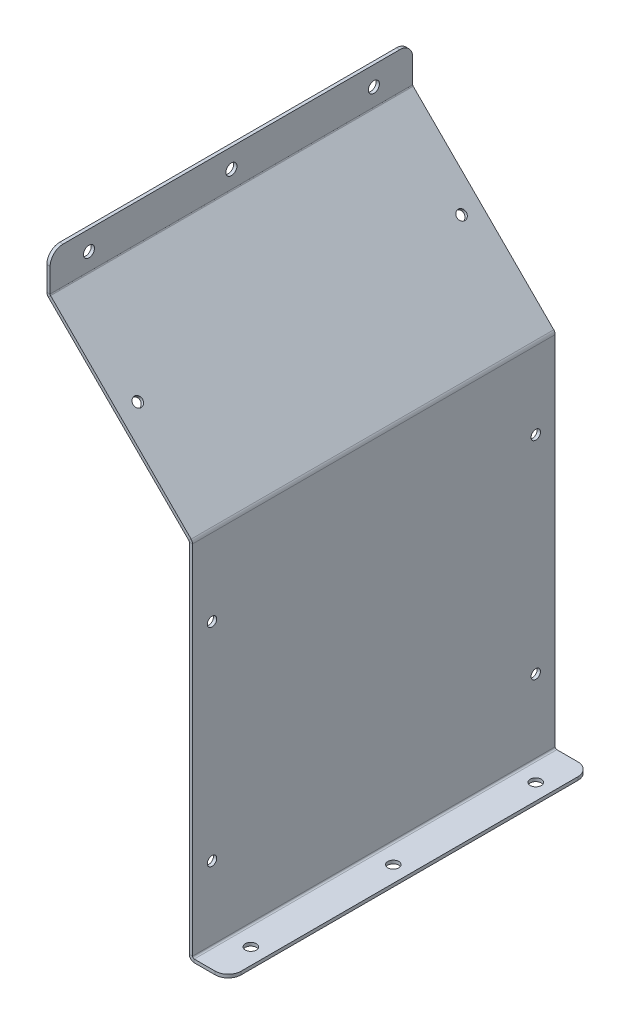
from build123d import *

# Parameters (mm, degrees)
BASE_FLANGE1_DEPTH       = 177.8
SKETCH2_R                = 2.7051
CUT_EXTRUDE1_0213_DEPTH  = 7.62
SKETCH3_R                = 2.3114
CUT_EXTRUDE2_0_182_DEPTH = 7.62
SKETCH4_R                = 2.3114
CUT_EXTRUDE4_0_182_DEPTH = 7.62
SKETCH5_R                = 2.7051
CUT_EXTRUDE3_0_213_DEPTH = 7.62
FILLET1_R                = 6.35


# Sheet-metal steps are written as plain solids
with BuildPart() as part:
    # Sketch1 → Base-Flange1 (new body)
    with BuildSketch(Plane.XY):
        with BuildLine():
            Line((-139.7, 266.7), (-139.7, 248.649497326))
            ThreePointArc((-139.7, 248.649497326), (-139.516321312, 247.726082204), (-138.993248663, 246.943248663))
            Line((-138.993248663, 246.943248663), (-70.088063608, 178.038063608))
            ThreePointArc((-70.088063608, 178.038063608), (-69.911870716, 177.77437231), (-69.85, 177.463327217))
            Line((-69.85, 177.463327217), (-69.85, 2.413))
            ThreePointArc((-69.85, 2.413), (-69.143248663, 0.706751337), (-67.437, 0))
            Line((-67.437, 0), (-50.8, 0))
            Line((-50.8, 0), (-50.8, 1.6002))
            Line((-50.8, 1.6002), (-67.437, 1.6002))
            ThreePointArc((-67.437, 1.6002), (-68.011736392, 1.838263608), (-68.2498, 2.413))
            Line((-68.2498, 2.413), (-68.2498, 177.463327217))
            ThreePointArc((-68.2498, 177.463327216), (-68.433478688, 178.386742339), (-68.956551337, 179.16957588))
            Line((-68.956551337, 179.16957588), (-137.861736392, 248.074760934))
            ThreePointArc((-137.861736392, 248.074760934), (-138.037929284, 248.338452232), (-138.0998, 248.649497326))
            Line((-138.0998, 248.649497326), (-138.0998, 266.7))
            Line((-138.0998, 266.7), (-139.7, 266.7))
        make_face()
    extrude(amount=BASE_FLANGE1_DEPTH)

    # Sketch2 → Cut-Extrude1 .0213 (cut)
    with BuildSketch(Plane.XZ):
        with Locations(Location((-58.7248, 19.05, 0), (0, 0, 270))):
            Circle(SKETCH2_R)
        with Locations(Location((-58.7248, 88.9, 0), (0, 0, 270))):
            Circle(SKETCH2_R)
        with Locations(Location((-58.7248, 158.75, 0), (0, 0, 270))):
            Circle(SKETCH2_R)
    extrude(amount=-CUT_EXTRUDE1_0213_DEPTH, mode=Mode.SUBTRACT)

    # Sketch3 → Cut-Extrude2 0.182 (cut)
    with BuildSketch(Plane(origin=(-68.2498, 0, 0), x_dir=(0, 0, -1), z_dir=(1, 0, 0))):
        with Locations(Location((-168.275, 139.7, 0), (0, 0, 90))):
            Circle(SKETCH3_R)
        with Locations(Location((-168.275, 38.1, 0), (0, 0, 90))):
            Circle(SKETCH3_R)
        with Locations(Location((-9.525, 139.7, 0), (0, 0, 90))):
            Circle(SKETCH3_R)
        with Locations(Location((-9.525, 38.1, 0), (0, 0, 90))):
            Circle(SKETCH3_R)
    extrude(amount=-CUT_EXTRUDE2_0_182_DEPTH, mode=Mode.SUBTRACT)

    # Sketch4 → Cut-Extrude4 0.182 (cut)
    with BuildSketch(Plane(origin=(55.106512271, 55.106512271, 0), x_dir=(0, 0, -1), z_dir=(0.7071067811865511, 0.707106781186544, 0))):
        with Locations(Location((-168.275, 225.914994361, 0), (0, 0, 90))):
            Circle(SKETCH4_R)
        with Locations(Location((-9.525, 225.914994361, 0), (0, 0, 90))):
            Circle(SKETCH4_R)
    extrude(amount=-CUT_EXTRUDE4_0_182_DEPTH, mode=Mode.SUBTRACT)

    # Sketch5 → Cut-Extrude3 0.213 (cut)
    with BuildSketch(Plane(origin=(-138.0998, 0, 0), x_dir=(0, 0, -1), z_dir=(1, 0, 0))):
        with Locations((-158.75, 257.175)):
            Circle(SKETCH5_R)
        with Locations((-88.9, 257.175)):
            Circle(SKETCH5_R)
        with Locations((-19.05, 257.175)):
            Circle(SKETCH5_R)
    extrude(amount=-CUT_EXTRUDE3_0_213_DEPTH, mode=Mode.SUBTRACT)

    # Fillet1
    fillet1_edges = [part.edges().sort_by_distance(p)[0] for p in [
        (-50.8, 0.8001, 0),
        (-138.8999, 266.7, 0),
        (-50.8, 0.8001, 177.8),
        (-138.8999, 266.7, 177.8),
    ]]
    fillet(fillet1_edges, radius=FILLET1_R)


solid = part.part
